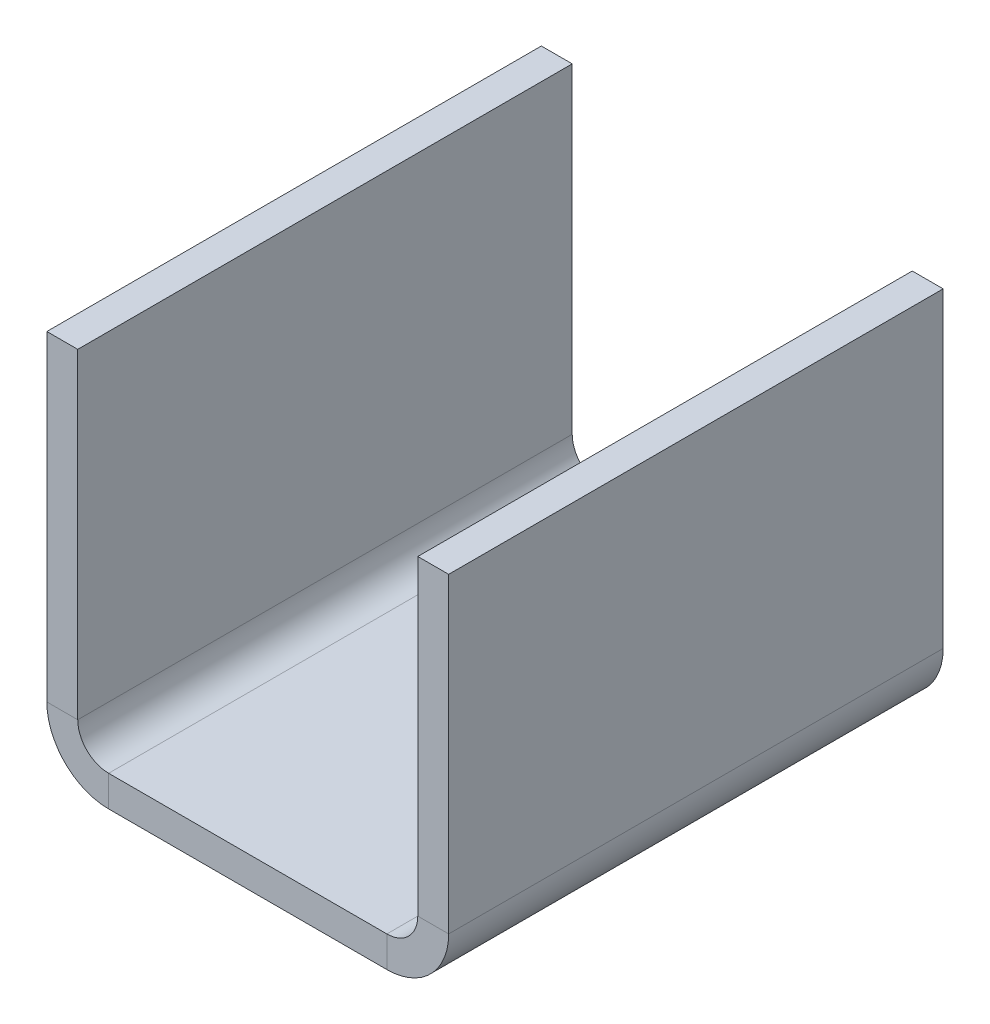
from build123d import *

# Parameters (mm, degrees)
BOSS_EXTRUDE1_DEPTH    = 38.1
CONVERT_SOLID1_DEPTH   = 38.1
CONVERT_SOLID1_2_DEPTH = 38.1


# Read off the part's stored shape, not the designer's step: Convert-Solid1
with BuildPart() as part:
    # Sketch1 → Boss-Extrude1 (new body)
    with BuildSketch(Plane.XY):
        Polygon((-38.191130673, 27.446595767), (-38.191130673, 0), (-11.295536696, 0), (-11.295536696, 26.723586817), (-9.263536696, 26.723586817), (-9.263536696, -2.032), (-40.223130673, -2.032), (-40.223130673, 27.446595767), align=None)
    extrude(amount=BOSS_EXTRUDE1_DEPTH)

    # Convert-Solid1 outline → Convert-Solid1 (cut)
    with BuildSketch(Plane.XY):
        with BuildLine():
            Line((-9.263536696, -2.032), (-9.263536696, 2.728000132))
            ThreePointArc((-9.263536696, 2.728000132), (-10.657708456, -0.63782824), (-14.023536828, -2.032))
            Line((-14.023536828, -2.032), (-9.263536696, -2.032))
        make_face()
        with BuildLine():
            Line((-40.223130673, -2.032), (-35.463130541, -2.032))
            ThreePointArc((-35.463130541, -2.032), (-38.828958913, -0.63782824), (-40.223130673, 2.728000132))
            Line((-40.223130673, 2.728000132), (-40.223130673, -2.032))
        make_face()
    extrude(amount=CONVERT_SOLID1_DEPTH, mode=Mode.SUBTRACT)

    # Convert-Solid1 2 outline → Convert-Solid1 2 (add)
    with BuildSketch(Plane.XY):
        with BuildLine():
            Line((-11.295536696, 0), (-11.295536696, 26.723586817))
            Line((-11.295536696, 26.723586817), (-11.643536762, 26.723586817))
            Line((-11.643536762, 26.723586817), (-11.643536762, 2.728000132))
            ThreePointArc((-11.643536762, 2.728000132), (-12.340622642, 1.045085946), (-14.023536828, 0.348000066))
            Line((-14.023536828, 0.348000066), (-35.463130541, 0.348000066))
            ThreePointArc((-35.463130541, 0.348000066), (-37.146044727, 1.045085946), (-37.843130607, 2.728000132))
            Line((-37.843130607, 2.728000132), (-37.843130607, 27.446595767))
            Line((-37.843130607, 27.446595767), (-38.191130673, 27.446595767))
            Line((-38.191130673, 27.446595767), (-38.191130673, 0))
            Line((-38.191130673, 0), (-11.295536696, 0))
        make_face()
    extrude(amount=CONVERT_SOLID1_2_DEPTH)


solid = part.part
